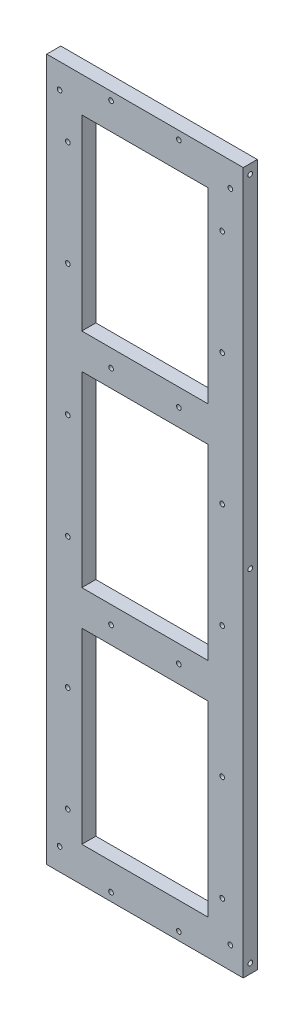
from build123d import *

# Parameters (mm, degrees)
SKETCH1_W           = 84
SKETCH1_H           = 300
SKETCH1_W_2         = 54
SKETCH1_H_2         = 80
BOSS_EXTRUDE1_DEPTH = 6
SKETCH2_R           = 1
CUT_EXTRUDE1_DEPTH  = 10
SKETCH4_R           = 1
CUT_EXTRUDE3_DEPTH  = 10
SKETCH5_R           = 1
CUT_EXTRUDE4_DEPTH  = 10


with BuildPart() as part:
    # Sketch1 → Boss-Extrude1 (new body)
    with BuildSketch(Plane.XY):
        Rectangle(SKETCH1_W, SKETCH1_H)
        with Locations((0, 95)):
            Rectangle(SKETCH1_W_2, SKETCH1_H_2, mode=Mode.SUBTRACT)
        with Locations((0, -95)):
            Rectangle(SKETCH1_W_2, SKETCH1_H_2, mode=Mode.SUBTRACT)
        Rectangle(SKETCH1_W_2, SKETCH1_H_2, mode=Mode.SUBTRACT)
    extrude(amount=BOSS_EXTRUDE1_DEPTH)

    # Sketch2 → Cut-Extrude1 (cut)
    with BuildSketch(Plane(origin=(42, 0, 0), x_dir=(0, 0, -1), z_dir=(1, 0, 0))):
        with Locations((-3, 146)):
            Circle(SKETCH2_R)
        with Locations((-3, 0)):
            Circle(SKETCH2_R)
        with Locations((-3, -146)):
            Circle(SKETCH2_R)
        with Locations((-3, -292)):
            Circle(SKETCH2_R)
    cut_extrude1 = extrude(amount=-CUT_EXTRUDE1_DEPTH, mode=Mode.SUBTRACT)

    # Mirror1: Cut-Extrude1 across plane
    add(cut_extrude1.mirror(Plane(origin=(0, 0, 0), x_dir=(0, 0, 1), z_dir=(1, 0, 0))), mode=Mode.SUBTRACT)

    # Sketch4 → Cut-Extrude3 (cut)
    with BuildSketch(Plane.XY.offset(6)):
        with Locations((-14.5, 146.5)):
            Circle(SKETCH4_R)
        with Locations((-33, 122)):
            Circle(SKETCH4_R)
        with Locations((-14.5, 47.5)):
            Circle(SKETCH4_R)
        with Locations((-14.5, -47.5)):
            Circle(SKETCH4_R)
        with Locations((-14.5, -146.5)):
            Circle(SKETCH4_R)
        with Locations((-33, -125)):
            Circle(SKETCH4_R)
        with Locations((-33, 77)):
            Circle(SKETCH4_R)
        with Locations((-33, -80)):
            Circle(SKETCH4_R)
        with Locations((-33, 21)):
            Circle(SKETCH4_R)
        with Locations((-33, -24)):
            Circle(SKETCH4_R)
        with Locations((33, -24)):
            Circle(SKETCH4_R)
        with Locations((33, 21)):
            Circle(SKETCH4_R)
        with Locations((33, -80)):
            Circle(SKETCH4_R)
        with Locations((33, 77)):
            Circle(SKETCH4_R)
        with Locations((33, -125)):
            Circle(SKETCH4_R)
        with Locations((14.5, -146.5)):
            Circle(SKETCH4_R)
        with Locations((14.5, -47.5)):
            Circle(SKETCH4_R)
        with Locations((14.5, 47.5)):
            Circle(SKETCH4_R)
        with Locations((33, 122)):
            Circle(SKETCH4_R)
        with Locations((14.5, 146.5)):
            Circle(SKETCH4_R)
    extrude(amount=-CUT_EXTRUDE3_DEPTH, mode=Mode.SUBTRACT)

    # Sketch5 → Cut-Extrude4 (cut)
    with BuildSketch(Plane.XY.offset(6)):
        with Locations((-36.5, -140.5)):
            Circle(SKETCH5_R)
        with Locations((36.5, -140.5)):
            Circle(SKETCH5_R)
        with Locations((-36.5, 139.5)):
            Circle(SKETCH5_R)
        with Locations((36.5, 139.5)):
            Circle(SKETCH5_R)
    extrude(amount=-CUT_EXTRUDE4_DEPTH, mode=Mode.SUBTRACT)


solid = part.part
